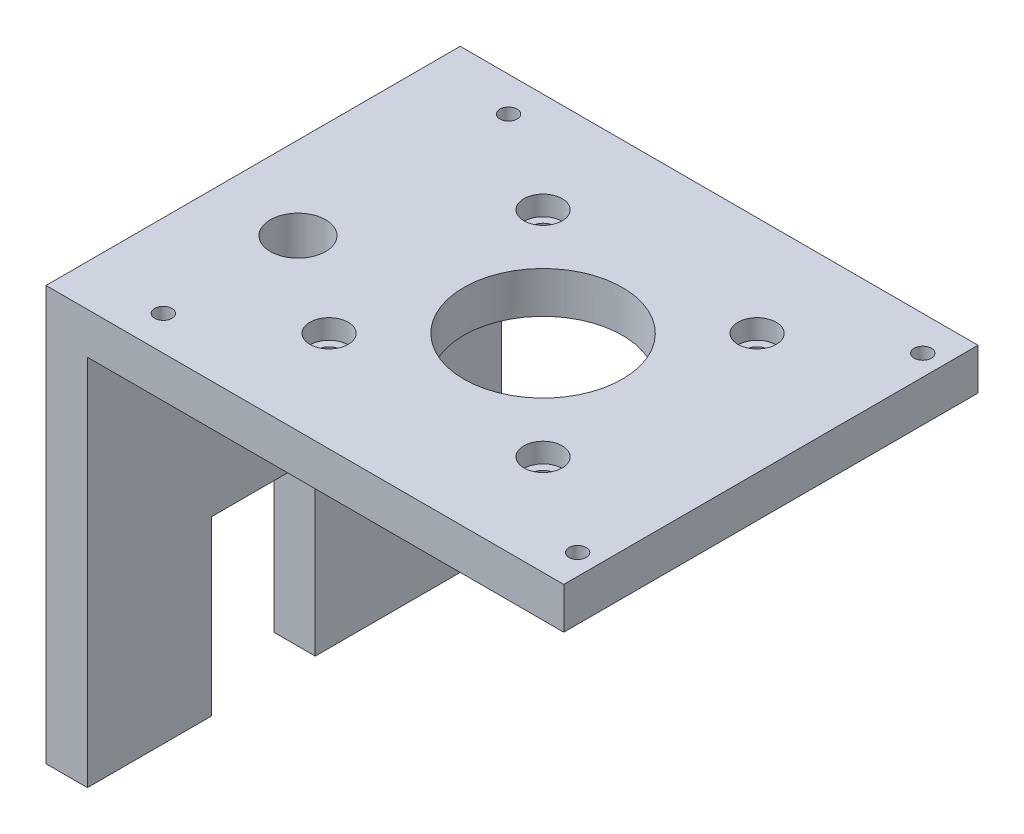
from build123d import *

# Parameters (mm, degrees)
BOSS_EXTRUDE1_DEPTH                            = 60
SKETCH2_R                                      = 11.5
CUT_EXTRUDE1_DEPTH                             = 114.247516529
CBORE_FOR_4_SOCKET_HEAD_CAP_SCREW1_D           = 3.2639
CBORE_FOR_4_SOCKET_HEAD_CAP_SCREW1_CBORE_D     = 5.55752
CBORE_FOR_4_SOCKET_HEAD_CAP_SCREW1_CBORE_DEPTH = 2.8448
M3_TAPPED_HOLE1_D                              = 2.5
M3_TAPPED_HOLE1_DEPTH                          = 8.5
M3_TAPPED_HOLE1_TIP                            = 0.751075774
SKETCH11_R                                     = 4
CUT_EXTRUDE2_DEPTH                             = 114.247516529
SKETCH12_W                                     = 15
SKETCH12_H                                     = 25
CUT_EXTRUDE3_DEPTH                             = 110.366356801


with BuildPart() as part:
    # Sketch1 → Boss-Extrude1 (new body)
    with BuildSketch(Plane.XY):
        Polygon((0, 0), (6, 0), (6, 54), (75, 54), (75, 60), (0, 60), align=None)
    extrude(amount=BOSS_EXTRUDE1_DEPTH)

    # Sketch2 → Cut-Extrude1 (cut, through all)
    with BuildSketch(Plane(origin=(0, 60, 0), x_dir=(1, 0, 0), z_dir=(0, 1, 0))):
        with Locations((42, -30)):
            Circle(SKETCH2_R)
    extrude(amount=-CUT_EXTRUDE1_DEPTH, mode=Mode.SUBTRACT)

    # CBORE for #4 Socket Head Cap Screw1 (through all)
    with Locations(Plane(origin=(0, 60, 0), x_dir=(-1, 0, 0), z_dir=(0, 1, 0))):
        with Locations((-26.5, 45.5), (-57.5, 45.5), (-26.5, 14.5), (-57.5, 14.5)):
            CounterBoreHole(CBORE_FOR_4_SOCKET_HEAD_CAP_SCREW1_D / 2, CBORE_FOR_4_SOCKET_HEAD_CAP_SCREW1_CBORE_D / 2, CBORE_FOR_4_SOCKET_HEAD_CAP_SCREW1_CBORE_DEPTH)

    # M3 Tapped Hole1
    with Locations(Plane(origin=(0, 60, 0), x_dir=(-1, 0, 0), z_dir=(0, 1, 0))):
        with Locations((-12, 55), (-72, 55), (-12, 5), (-72, 5)):
            Hole(M3_TAPPED_HOLE1_D / 2, depth=M3_TAPPED_HOLE1_DEPTH)
            with Locations((0, 0, -(M3_TAPPED_HOLE1_DEPTH + M3_TAPPED_HOLE1_TIP / 2))):  # 118° drill point
                Cone(0, M3_TAPPED_HOLE1_D / 2, M3_TAPPED_HOLE1_TIP, mode=Mode.SUBTRACT)

    # Sketch11 → Cut-Extrude2 (cut, through all)
    with BuildSketch(Plane(origin=(0, 60, 0), x_dir=(1, 0, 0), z_dir=(0, 1, 0))):
        with Locations((12, -35.5)):
            Circle(SKETCH11_R)
    extrude(amount=-CUT_EXTRUDE2_DEPTH, mode=Mode.SUBTRACT)

    # Sketch12 → Cut-Extrude3 (cut, through all)
    with BuildSketch(Plane(origin=(6, 0, 0), x_dir=(0, 0, -1), z_dir=(1, 0, 0))):
        with Locations((-34.5, 12.5)):
            Rectangle(SKETCH12_W, SKETCH12_H)
    extrude(amount=-CUT_EXTRUDE3_DEPTH, mode=Mode.SUBTRACT)


solid = part.part
